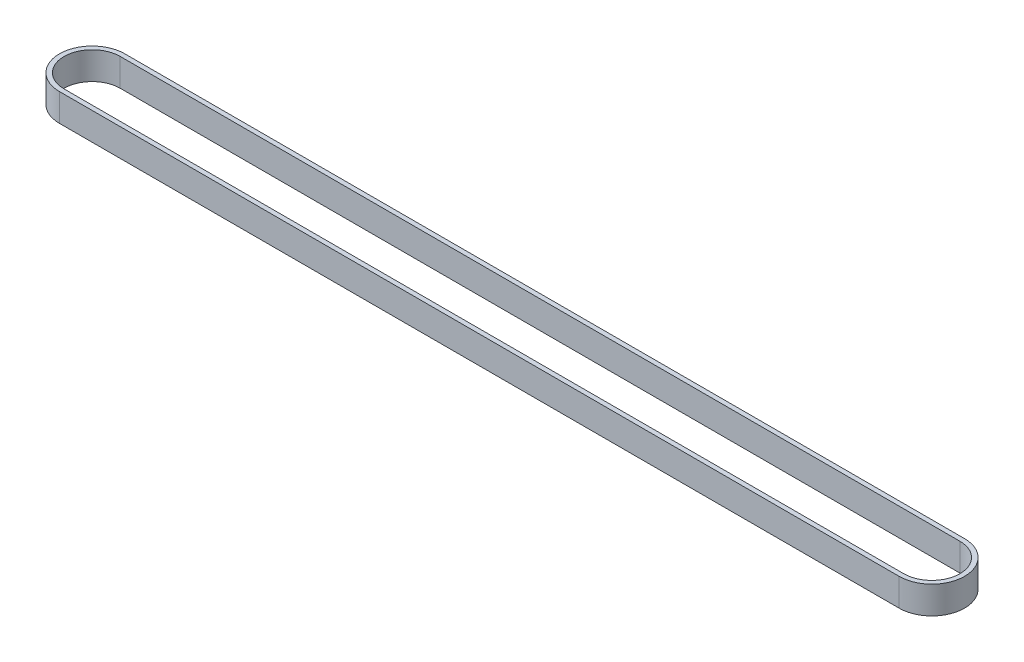
from build123d import *

# Parameters (mm, degrees)
BOSS_EXTRUDE1_DEPTH = 6


with BuildPart() as part:
    # Sketch1 → Boss-Extrude1 (new body)
    with BuildSketch(Plane(origin=(0, 0, 0), x_dir=(1, 0, 0), z_dir=(0, 1, 0))):
        with BuildLine():
            Line((0, 7.11), (182.64, 7.11))
            ThreePointArc((182.64, 7.11), (189.75, 0), (182.64, -7.11))
            Line((182.64, -7.11), (0, -7.11))
            ThreePointArc((0, -7.11), (-7.11, 0), (0, 7.11))
        make_face()
        with BuildLine():
            Line((0, 6.112197724), (182.64, 6.112197724))
            ThreePointArc((182.64, 6.112197724), (188.752197724, 0), (182.64, -6.112197724))
            Line((182.64, -6.112197724), (0, -6.112197724))
            ThreePointArc((0, -6.112197724), (-6.112197724, 0), (0, 6.112197724))
        make_face(mode=Mode.SUBTRACT)
    extrude(amount=BOSS_EXTRUDE1_DEPTH)


solid = part.part
